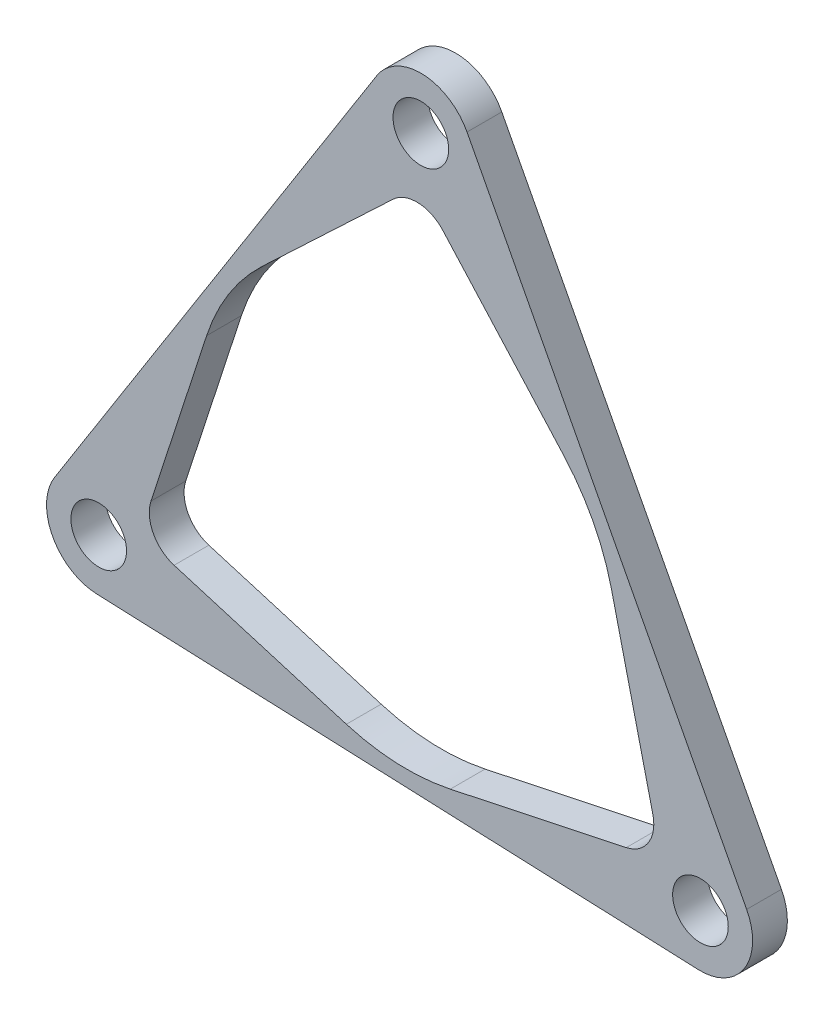
from build123d import *

# Parameters (mm, degrees)
SKETCH1_R           = 1.6
BOSS_EXTRUDE1_DEPTH = 2


with BuildPart() as part:
    # Sketch1 → Boss-Extrude1 (new body)
    with BuildSketch(Plane.XY):
        with BuildLine():
            Line((19.555706533, -9.304533411), (3.471946359, 21.376285657))
            ThreePointArc((3.471946359, 21.376285657), (0.93714591, 22.980899842), (-1.719890963, 21.588005352))
            Line((-1.719890963, 21.588005352), (-20.248379597, -7.681349081))
            ThreePointArc((-20.248379597, -7.681349081), (-20.37061602, -10.678857756), (-17.835815571, -12.283471941))
            Line((-17.835815571, -12.283471941), (16.776433238, -13.694936576))
            ThreePointArc((16.776433238, -13.694936576), (19.43347011, -12.302042086), (19.555706533, -9.304533411))
        make_face()
        with BuildLine():
            Line((-8.306162696, 8.798730663), (-0.783837106, 15.899943621))
            ThreePointArc((-0.783837106, 15.899943621), (0.670573296, 16.443947091), (2.075859948, 15.783327064))
            Line((2.075859948, 15.783327064), (8.995004486, 8.093200498))
            ThreePointArc((8.995004486, 8.093200498), (10.716715384, 5.618007776), (11.773005623, 2.793982571))
            Line((11.773005623, 2.793982571), (14.161673647, -7.271148964))
            ThreePointArc((14.161673647, -7.271148964), (13.905589271, -8.802707055), (12.63083222, -9.689410982))
            Line((12.63083222, -9.689410982), (2.511414986, -11.836502641))
            ThreePointArc((2.511414986, -11.836502641), (-0.493020239, -12.089951656), (-3.466842927, -11.592713234))
            Line((-3.466842927, -11.592713234), (-13.377836541, -8.628794657))
            ThreePointArc((-13.377836541, -8.628794657), (-14.576162567, -7.641240036), (-14.706692168, -6.093916082))
            Line((-14.706692168, -6.093916082), (-11.506419472, 3.743302143))
            ThreePointArc((-11.506419472, 3.743302143), (-10.223695145, 6.47194388), (-8.306162696, 8.798730663))
        make_face(mode=Mode.SUBTRACT)
        with Locations((0.814909487, 19.983391167)):
            Circle(SKETCH1_R, mode=Mode.SUBTRACT)
        with Locations((16.898669661, -10.697427901)):
            Circle(SKETCH1_R, mode=Mode.SUBTRACT)
        with Locations((-17.713579148, -9.285963266)):
            Circle(SKETCH1_R, mode=Mode.SUBTRACT)
    extrude(amount=BOSS_EXTRUDE1_DEPTH)


solid = part.part
